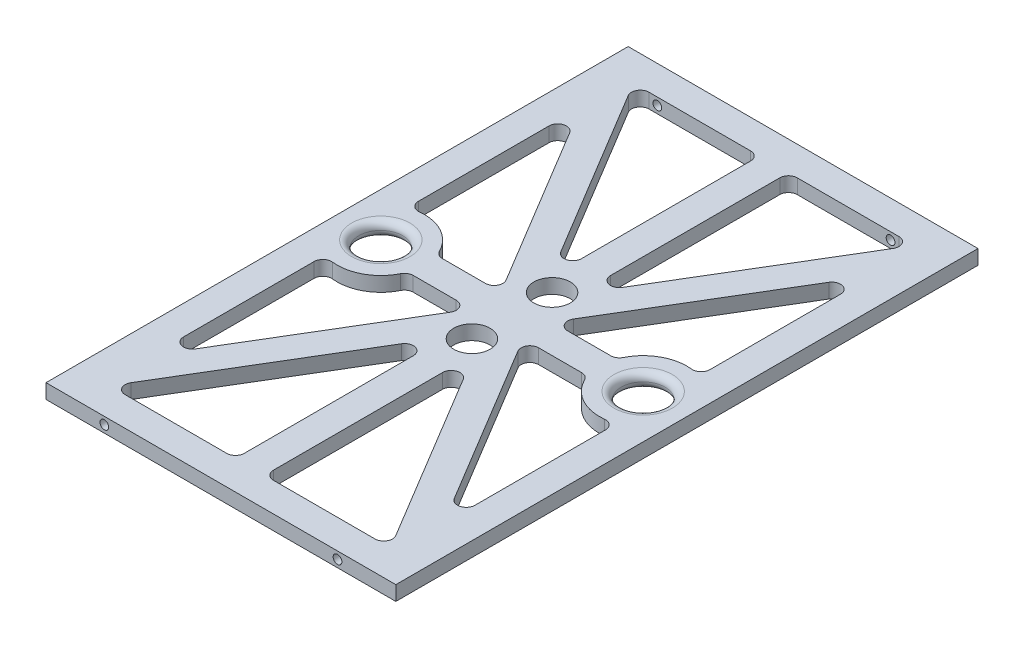
from build123d import *

# Parameters (mm, degrees)
SKETCH1_W                    = 152.4
SKETCH1_H                    = 6.35
BOSS_EXTRUDE1_DEPTH          = 126.8095
F_3_4_0_75_DIAMETER_HOLE1_D  = 19.05
CUT_EXTRUDE1_DEPTH           = 199.360106348
FILLET1_R                    = 3.81
FILLET4_R                    = 3.175
F_5_8_0_625_DIAMETER_HOLE1_D = 15.875
F_10_24_TAPPED_HOLE1_D       = 3.7973
F_10_24_TAPPED_HOLE1_DEPTH   = 19.05
F_10_24_TAPPED_HOLE1_TIP     = 1.140824014
F_10_24_TAPPED_HOLE2_D       = 3.7973
F_10_24_TAPPED_HOLE2_DEPTH   = 19.05
F_10_24_TAPPED_HOLE2_TIP     = 1.140824014


with BuildPart() as part:
    # Sketch1 → Boss-Extrude1 (new, symmetric)
    with BuildSketch(Plane.XY):
        with Locations((76.2, 3.175)):
            Rectangle(SKETCH1_W, SKETCH1_H)
    extrude(amount=BOSS_EXTRUDE1_DEPTH, both=True)

    # 3/4 (0.75) Diameter Hole1 (through all)
    with Locations(Plane(origin=(0, 6.35, 0), x_dir=(1, 0, 0), z_dir=(0, 1, 0))):
        with Locations((19.05, 0), (133.35, 0)):
            Hole(F_3_4_0_75_DIAMETER_HOLE1_D / 2)

    # Sketch4 → Cut-Extrude1 (cut, through all)
    with BuildSketch(Plane(origin=(0, 6.35, 0), x_dir=(1, 0, 0), z_dir=(0, 1, 0))):
        with BuildLine():
            Line((37.010512242, -6.35), (64.976021122, -6.35))
            Line((64.976021122, -6.35), (12.7, -93.346011817))
            Line((12.7, -93.346011817), (12.7, -17.960512242))
            ThreePointArc((12.7, -17.960512242), (27.259871939, -17.190128061), (37.010512242, -6.35))
        make_face()
        with BuildLine():
            Line((12.7, 93.346011817), (64.976021122, 6.35))
            Line((64.976021122, 6.35), (37.010512242, 6.35))
            ThreePointArc((37.010512242, 6.35), (27.259871939, 17.190128061), (12.7, 17.960512242))
            Line((12.7, 17.960512242), (12.7, 93.346011817))
        make_face()
        Polygon((137.360297537, 114.1095), (82.55, 22.896029849), (82.55, 114.1095), align=None)
        Polygon((15.039702463, 114.1095), (69.85, 22.896029849), (69.85, 114.1095), align=None)
        with BuildLine():
            Line((139.7, 93.346011817), (87.423978878, 6.35))
            Line((87.423978878, 6.35), (115.389487758, 6.35))
            ThreePointArc((115.389487758, 6.35), (125.140128061, 17.190128061), (139.7, 17.960512242))
            Line((139.7, 17.960512242), (139.7, 93.346011817))
        make_face()
        Polygon((15.039702463, -114.1095), (69.85, -114.1095), (69.85, -22.896029849), align=None)
        with BuildLine():
            Line((139.7, -93.346011817), (139.7, -17.960512242))
            ThreePointArc((139.7, -17.960512242), (125.140128061, -17.190128061), (115.389487758, -6.35))
            Line((115.389487758, -6.35), (87.423978878, -6.35))
            Line((87.423978878, -6.35), (139.7, -93.346011817))
        make_face()
        Polygon((82.55, -22.896029849), (137.360297537, -114.1095), (82.55, -114.1095), align=None)
    extrude(amount=-CUT_EXTRUDE1_DEPTH, mode=Mode.SUBTRACT)

    # Fillet1
    fillet1_edges = [part.edges().sort_by_distance(p)[0] for p in [
        (64.976021122, 3.175, 6.35),
        (12.7, 3.175, 93.346011817),
        (12.7, 3.175, 17.960512242),
        (37.010512242, 3.175, 6.35),
        (139.7, 3.175, -93.346011817),
        (139.7, 3.175, -17.960512242),
        (115.389487758, 3.175, -6.35),
        (87.423978878, 3.175, -6.35),
        (115.389487758, 3.175, 6.35),
        (139.7, 3.175, 17.960512242),
        (139.7, 3.175, 93.346011817),
        (87.423978878, 3.175, 6.35),
        (12.7, 3.175, -17.960512242),
        (12.7, 3.175, -93.346011817),
        (64.976021122, 3.175, -6.35),
        (37.010512242, 3.175, -6.35),
        (15.039702463, 3.175, 114.1095),
        (69.85, 3.175, 22.896029849),
        (69.85, 3.175, 114.1095),
        (137.360297537, 3.175, 114.1095),
        (82.55, 3.175, 114.1095),
        (82.55, 3.175, 22.896029849),
        (82.55, 3.175, -114.1095),
        (137.360297537, 3.175, -114.1095),
        (82.55, 3.175, -22.896029849),
        (15.039702463, 3.175, -114.1095),
        (69.85, 3.175, -114.1095),
        (69.85, 3.175, -22.896029849),
    ]]
    fillet(fillet1_edges, radius=FILLET1_R)

    # Fillet4
    fillet4_edges = [part.edges().sort_by_distance(p)[0] for p in [
        (142.875, 6.35, 0),
        (142.875, 0, 0),
        (28.575, 6.35, 0),
        (28.575, 0, 0),
    ]]
    fillet(fillet4_edges, radius=FILLET4_R - 0.0001)  # a hair under: the kernel refuses the full size

    # 5/8 (0.625) Diameter Hole1 (through all)
    with Locations(Plane(origin=(0, 0, 0), x_dir=(-1, 0, 0), z_dir=(0, -1, 0))):
        with Locations((-76.2, 17.4625), (-76.2, -17.4625)):
            Hole(F_5_8_0_625_DIAMETER_HOLE1_D / 2)

    # #10-24 Tapped Hole1
    with Locations(Plane.XY.offset(126.8095)):
        with Locations((127, 3.175), (25.4, 3.175)):
            Hole(F_10_24_TAPPED_HOLE1_D / 2, depth=F_10_24_TAPPED_HOLE1_DEPTH)
            with Locations((0, 0, -(F_10_24_TAPPED_HOLE1_DEPTH + F_10_24_TAPPED_HOLE1_TIP / 2))):  # 118° drill point
                Cone(0, F_10_24_TAPPED_HOLE1_D / 2, F_10_24_TAPPED_HOLE1_TIP, mode=Mode.SUBTRACT)

    # #10-24 Tapped Hole2
    with Locations(Plane(origin=(0, 0, -126.8095), x_dir=(-1, 0, 0), z_dir=(0, 0, -1))):
        with Locations((-25.4, 3.175), (-127, 3.175)):
            Hole(F_10_24_TAPPED_HOLE2_D / 2, depth=F_10_24_TAPPED_HOLE2_DEPTH)
            with Locations((0, 0, -(F_10_24_TAPPED_HOLE2_DEPTH + F_10_24_TAPPED_HOLE2_TIP / 2))):  # 118° drill point
                Cone(0, F_10_24_TAPPED_HOLE2_D / 2, F_10_24_TAPPED_HOLE2_TIP, mode=Mode.SUBTRACT)


solid = part.part
